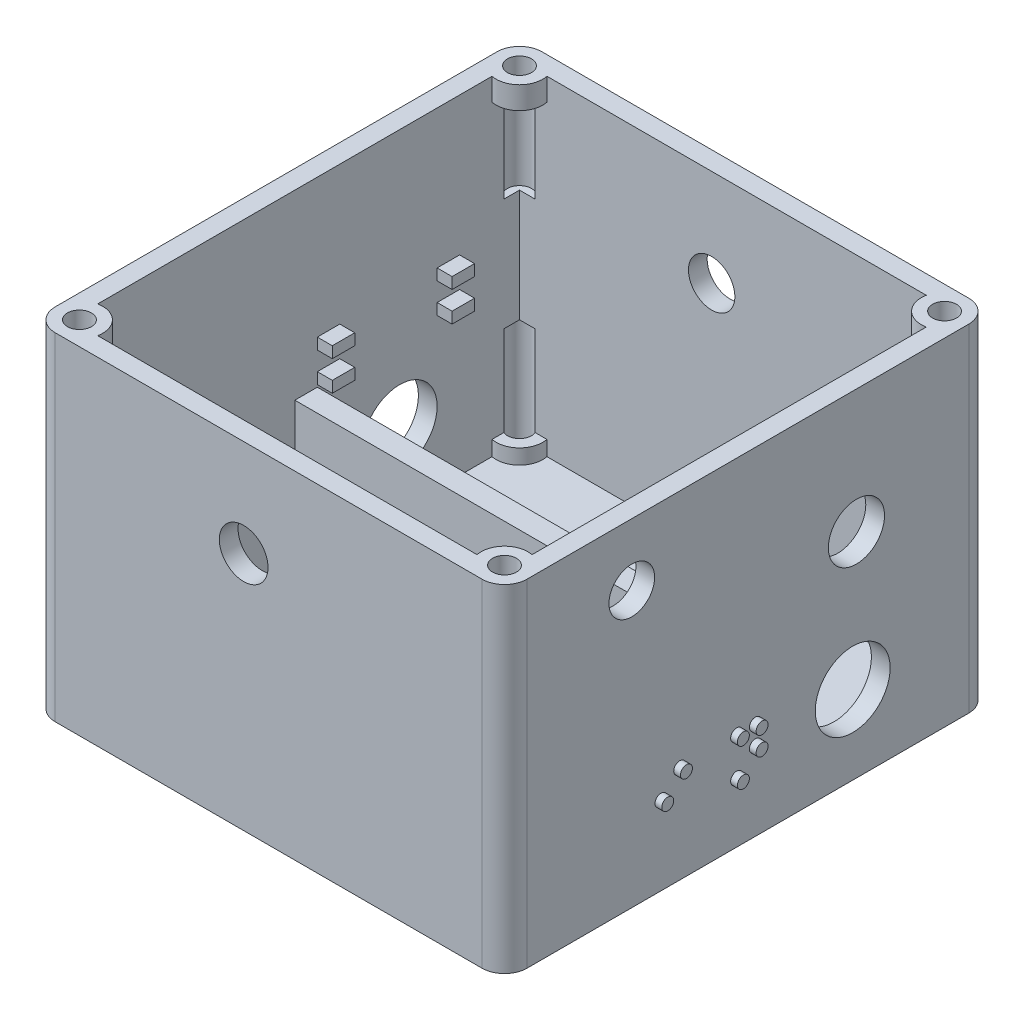
from build123d import *

# Parameters (mm, degrees)
BASE_SKETCH_W                         = 63
BASE_SKETCH_H                         = 65
BASE_SKETCH_W_2                       = 58
BASE_SKETCH_H_2                       = 60
WALLS_DEPTH                           = 45
CLIPS_START                           = 2.5
CLIPS_TOP_OUTLINE_W                   = 1.5
CLIPS_TOP_OUTLINE_H                   = 3
CLIPS_TOP_DEPTH                       = 2
CLIPS_BOTTOM_OUTLINE_W                = 1.5
CLIPS_BOTTOM_OUTLINE_H                = 3
CLIPS_BOTTOM_DEPTH                    = 2
PHONE_START                           = 70
JACK_ENCODER_R                        = 3.05
JACK_ENCODER_R_2                      = 3.75
PHONE_JACK_ENCODER_DEPTH              = 23
FILLET1_R                             = 3
ON_OFF_START                          = -50
ON_OFF_SWITCH_R                       = 3.1
ON_OFF_TOGGLE_SWITCH_HOLE_DEPTH       = 23
BRAILLE_START                         = -65
ON_OFF_SWITCH_7_R                     = 0.8
BRAILLE_ON_OFF_DEPTH                  = 0.9
GUITAR_JACKS_DEPTH                    = 101.140201717
GUITAR_JACKS_DEPTH_BACK               = 101.140201717
GUITAR_PORTS_R                        = 5
POTENTIOMETER_HOLE_R                  = 3.25
POTENTIOMETER_DEPTH                   = 10
INNER_WALL_DEPTH                      = 20.7
BASE_SKETCH_12_W                      = 58
BASE_SKETCH_12_H                      = 27
INNER_WALL_BOTTOM_DEPTH               = 1
HOLES_4_R                             = 1.6
MOUNTING_HOLES_BOTTOM_CUT_DEPTH       = 15
MOUNTING_START                        = 30
HOLES_R                               = 1.6
MOUNTING_HOLES_TOP_CUT_DEPTH          = 15
HOLES_6_R                             = 3.115503651
HOLES_6_R_2                           = 1.6
MOUNTING_HOLES_REINFORCE_BOTTOM_DEPTH = 3
MOUNTING_START_2                      = 42
HOLES_7_R                             = 3.115503651
HOLES_7_R_2                           = 1.6
MOUNTING_HOLES_REINFORCE_TOP_DEPTH    = 3
BRAILLE_EXTRUDE_START                 = 63
BRAILLE_IN_R                          = 0.8
BRAILLE_EXTRUDE_IN_DEPTH              = 0.9
BRAILLE_OUT_R                         = 0.8
BRAILLE_EXTRUDE_OUT_DEPTH             = 0.9


# Read off the part's stored shape, not the designer's step: Clips Top, Clips Bottom
with BuildPart() as part:
    # Base Sketch → Walls (new body)
    with BuildSketch(Plane(origin=(0, 0, 0), x_dir=(1, 0, 0), z_dir=(0, 1, 0))):
        with Locations((31.5, 32.5)):
            Rectangle(BASE_SKETCH_W, BASE_SKETCH_H)
        with Locations((31.5, 32.5)):
            Rectangle(BASE_SKETCH_W_2, BASE_SKETCH_H_2, mode=Mode.SUBTRACT)
    extrude(amount=WALLS_DEPTH)

    # Clips Top outline → Clips Top (add)
    with BuildSketch(Plane.YZ.offset(CLIPS_START)):
        with Locations((25.75, -53)):
            Rectangle(CLIPS_TOP_OUTLINE_W, CLIPS_TOP_OUTLINE_H)
        with Locations((25.75, -37)):
            Rectangle(CLIPS_TOP_OUTLINE_W, CLIPS_TOP_OUTLINE_H)
    extrude(amount=CLIPS_TOP_DEPTH)

    # Clips Bottom outline → Clips Bottom (add)
    with BuildSketch(Plane.YZ.offset(CLIPS_START)):
        with Locations((21.75, -53)):
            Rectangle(CLIPS_BOTTOM_OUTLINE_W, CLIPS_BOTTOM_OUTLINE_H)
        with Locations((21.75, -37)):
            Rectangle(CLIPS_BOTTOM_OUTLINE_W, CLIPS_BOTTOM_OUTLINE_H)
    extrude(amount=CLIPS_BOTTOM_DEPTH)

    # Jack & Encoder → Phone Jack+Encoder (cut)
    with BuildSketch(Plane(origin=(0, 0, 0), x_dir=(0, 0, -1), z_dir=(1, 0, 0)).offset(PHONE_START)):
        with Locations((17, 36.7)):
            Circle(JACK_ENCODER_R)
        with Locations((47, 28.498025774)):
            Circle(JACK_ENCODER_R_2)
    extrude(amount=-PHONE_JACK_ENCODER_DEPTH, mode=Mode.SUBTRACT)

    # Fillet1
    fillet1_edges = [part.edges().sort_by_distance(p)[0] for p in [
        (0, 22.5, 0),
        (0, 22.5, -65),
        (63, 22.5, -65),
        (63, 22.5, 0),
    ]]
    fillet(fillet1_edges, radius=FILLET1_R)

    # On-off Switch → On-off toggle switch hole (cut)
    with BuildSketch(Plane.XY.offset(ON_OFF_START)):
        with Locations((28.164403996, 32.056003541)):
            Circle(ON_OFF_SWITCH_R)
    extrude(amount=-ON_OFF_TOGGLE_SWITCH_HOLE_DEPTH, mode=Mode.SUBTRACT)

    # On-off Switch<7> → Braille On-off (add)
    with BuildSketch(Plane.XY.offset(BRAILLE_START)):
        with Locations((8.064403996, 30.988882574)):
            Circle(ON_OFF_SWITCH_7_R)
        with Locations((8.064403996, 33.488882574)):
            Circle(ON_OFF_SWITCH_7_R)
        with Locations((10.564403996, 28.488882574)):
            Circle(ON_OFF_SWITCH_7_R)
        with Locations((15.664403996, 30.988882574)):
            Circle(ON_OFF_SWITCH_7_R)
        with Locations((18.164403996, 28.488882574)):
            Circle(ON_OFF_SWITCH_7_R)
        with Locations((18.164403996, 33.488882574)):
            Circle(ON_OFF_SWITCH_7_R)
        with Locations((55.864403996, 33.079675966)):
            Circle(ON_OFF_SWITCH_7_R)
        with Locations((38.164403996, 33.079675966)):
            Circle(ON_OFF_SWITCH_7_R)
        with Locations((40.664403996, 33.079675966)):
            Circle(ON_OFF_SWITCH_7_R)
        with Locations((40.664403996, 30.579675966)):
            Circle(ON_OFF_SWITCH_7_R)
        with Locations((45.764403996, 33.079675966)):
            Circle(ON_OFF_SWITCH_7_R)
        with Locations((48.264403996, 33.079675966)):
            Circle(ON_OFF_SWITCH_7_R)
        with Locations((48.264403996, 30.579675966)):
            Circle(ON_OFF_SWITCH_7_R)
        with Locations((55.864403996, 28.079675966)):
            Circle(ON_OFF_SWITCH_7_R)
        with Locations((53.364403996, 30.579675966)):
            Circle(ON_OFF_SWITCH_7_R)
    extrude(amount=-BRAILLE_ON_OFF_DEPTH)

    # Guitar ports → Guitar jacks (cut, two sides: drawn at the far end of the back side and taken through both)
    with BuildSketch(Plane(origin=(2.5, 0, 0), x_dir=(0, 0, -1), z_dir=(1, 0, 0)).offset(-GUITAR_JACKS_DEPTH_BACK)):
        with Locations((46.5, 10.5)):
            Circle(GUITAR_PORTS_R)
    extrude(amount=GUITAR_JACKS_DEPTH + GUITAR_JACKS_DEPTH_BACK, mode=Mode.SUBTRACT)

    # Potentiometer hole → Potentiometer (cut)
    with BuildSketch(Plane.XY):
        with Locations((28.164403996, 32.056003541)):
            Circle(POTENTIOMETER_HOLE_R)
    extrude(amount=-POTENTIOMETER_DEPTH, mode=Mode.SUBTRACT)

    # Base Sketch<11> → Inner-wall (add)
    with BuildSketch(Plane(origin=(0, 0, 0), x_dir=(1, 0, 0), z_dir=(0, 1, 0))):
        Polygon((60.5, 32.5), (60.5, 35.5), (4.5, 35.5), (2.5, 35.5), (2.5, 32.5), align=None)
    extrude(amount=INNER_WALL_DEPTH)

    # Base Sketch<12> → Inner-wall bottom (add)
    with BuildSketch(Plane(origin=(0, 0, 0), x_dir=(1, 0, 0), z_dir=(0, 1, 0))):
        with Locations((31.5, 49)):
            Rectangle(BASE_SKETCH_12_W, BASE_SKETCH_12_H)
    extrude(amount=INNER_WALL_BOTTOM_DEPTH)

    # Holes<4> → Mounting Holes Bottom Cut (cut)
    with BuildSketch(Plane(origin=(0, 0, 0), x_dir=(1, 0, 0), z_dir=(0, 1, 0))):
        with Locations(Location((59.884496349, 61.884496349, 0), (0, 0, 157.375517099))):
            Circle(HOLES_4_R)
        with Locations(Location((3.115503651, 61.884496349, 0), (0, 0, 22.624482901))):
            Circle(HOLES_4_R)
        with Locations((3.115503651, 3.115503651)):
            Circle(HOLES_4_R)
        with Locations((59.884496349, 3.115503651)):
            Circle(HOLES_4_R)
    extrude(amount=MOUNTING_HOLES_BOTTOM_CUT_DEPTH, mode=Mode.SUBTRACT)

    # Holes → Mounting Holes Top Cut (cut)
    with BuildSketch(Plane(origin=(0, 0, 0), x_dir=(1, 0, 0), z_dir=(0, 1, 0)).offset(MOUNTING_START)):
        with Locations(Location((3.115503651, 61.884496349, 0), (0, 0, 22.624482901))):
            Circle(HOLES_R)
        with Locations(Location((59.884496349, 61.884496349, 0), (0, 0, 157.375517099))):
            Circle(HOLES_R)
        with Locations((59.884496349, 3.115503651)):
            Circle(HOLES_R)
        with Locations((3.115503651, 3.115503651)):
            Circle(HOLES_R)
    extrude(amount=MOUNTING_HOLES_TOP_CUT_DEPTH, mode=Mode.SUBTRACT)

    # Holes<6> → Mounting Holes Reinforce Bottom (add)
    # profile 1 of 4: a face of its own
    with BuildSketch(Plane(origin=(0, 0, 0), x_dir=(1, 0, 0), z_dir=(0, 1, 0))):
        with Locations((3.115503651, 3.115503651)):
            Circle(HOLES_6_R)
        with Locations(Location((3.115503651, 3.115503651, 0), (0, 0, 112.624482901))):
            Circle(HOLES_6_R_2, mode=Mode.SUBTRACT)
    # profile 2 of 4: a face of its own
    with BuildSketch(Plane(origin=(0, 0, 0), x_dir=(1, 0, 0), z_dir=(0, 1, 0))):
        with Locations((59.884496349, 3.115503651)):
            Circle(HOLES_6_R)
        with Locations(Location((59.884496349, 3.115503651, 0), (0, 0, 67.375517099))):
            Circle(HOLES_6_R_2, mode=Mode.SUBTRACT)
    # profile 3 of 4: a face of its own
    with BuildSketch(Plane(origin=(0, 0, 0), x_dir=(1, 0, 0), z_dir=(0, 1, 0))):
        with Locations((59.884496349, 61.884496349)):
            Circle(HOLES_6_R)
        with Locations(Location((59.884496349, 61.884496349, 0), (0, 0, 157.375517099))):
            Circle(HOLES_6_R_2, mode=Mode.SUBTRACT)
    # profile 4 of 4: a face of its own
    with BuildSketch(Plane(origin=(0, 0, 0), x_dir=(1, 0, 0), z_dir=(0, 1, 0))):
        with Locations((3.115503651, 61.884496349)):
            Circle(HOLES_6_R)
        with Locations(Location((3.115503651, 61.884496349, 0), (0, 0, 22.624482901))):
            Circle(HOLES_6_R_2, mode=Mode.SUBTRACT)
    extrude(amount=MOUNTING_HOLES_REINFORCE_BOTTOM_DEPTH)

    # Holes<7> → Mounting Holes Reinforce Top (add)
    # profile 1 of 4: a face of its own
    with BuildSketch(Plane(origin=(0, 0, 0), x_dir=(1, 0, 0), z_dir=(0, 1, 0)).offset(MOUNTING_START_2)):
        with Locations((3.115503651, 3.115503651)):
            Circle(HOLES_7_R)
        with Locations(Location((3.115503651, 3.115503651, 0), (0, 0, 112.624482901))):
            Circle(HOLES_7_R_2, mode=Mode.SUBTRACT)
    # profile 2 of 4: a face of its own
    with BuildSketch(Plane(origin=(0, 0, 0), x_dir=(1, 0, 0), z_dir=(0, 1, 0)).offset(MOUNTING_START_2)):
        with Locations((59.884496349, 3.115503651)):
            Circle(HOLES_7_R)
        with Locations(Location((59.884496349, 3.115503651, 0), (0, 0, 67.375517099))):
            Circle(HOLES_7_R_2, mode=Mode.SUBTRACT)
    # profile 3 of 4: a face of its own
    with BuildSketch(Plane(origin=(0, 0, 0), x_dir=(1, 0, 0), z_dir=(0, 1, 0)).offset(MOUNTING_START_2)):
        with Locations((59.884496349, 61.884496349)):
            Circle(HOLES_7_R)
        with Locations(Location((59.884496349, 61.884496349, 0), (0, 0, 157.375517099))):
            Circle(HOLES_7_R_2, mode=Mode.SUBTRACT)
    # profile 4 of 4: a face of its own
    with BuildSketch(Plane(origin=(0, 0, 0), x_dir=(1, 0, 0), z_dir=(0, 1, 0)).offset(MOUNTING_START_2)):
        with Locations((3.115503651, 61.884496349)):
            Circle(HOLES_7_R)
        with Locations(Location((3.115503651, 61.884496349, 0), (0, 0, 22.624482901))):
            Circle(HOLES_7_R_2, mode=Mode.SUBTRACT)
    extrude(amount=MOUNTING_HOLES_REINFORCE_TOP_DEPTH)

    # Braille In → Braille-extrude In (add)
    with BuildSketch(Plane(origin=(0, 0, 0), x_dir=(0, 0, -1), z_dir=(1, 0, 0)).offset(BRAILLE_EXTRUDE_START)):
        with Locations(Location((20.9, 10.5, 0), (0, 0, 180))):
            Circle(BRAILLE_IN_R)
        with Locations(Location((23.4, 13, 0), (0, 0, 180))):
            Circle(BRAILLE_IN_R)
        with Locations(Location((31, 13, 0), (0, 0, 180))):
            Circle(BRAILLE_IN_R)
        with Locations(Location((33.5, 10.5, 0), (0, 0, 180))):
            Circle(BRAILLE_IN_R)
        with Locations(Location((33.5, 13, 0), (0, 0, 180))):
            Circle(BRAILLE_IN_R)
        with Locations(Location((31, 8, 0), (0, 0, 180))):
            Circle(BRAILLE_IN_R)
    extrude(amount=BRAILLE_EXTRUDE_IN_DEPTH)

    # Braille Out → Braille-extrude Out (add)
    with BuildSketch(Plane(origin=(0, 0, 0), x_dir=(0, 0, -1), z_dir=(1, 0, 0))):
        with Locations((17.3, 13)):
            Circle(BRAILLE_OUT_R)
        with Locations((17.3, 10.5)):
            Circle(BRAILLE_OUT_R)
        with Locations((19.8, 10.5)):
            Circle(BRAILLE_OUT_R)
        with Locations((19.8, 8)):
            Circle(BRAILLE_OUT_R)
        with Locations((24.9, 8)):
            Circle(BRAILLE_OUT_R)
        with Locations((27.4, 8)):
            Circle(BRAILLE_OUT_R)
        with Locations((27.4, 13)):
            Circle(BRAILLE_OUT_R)
        with Locations((32.5, 10.5)):
            Circle(BRAILLE_OUT_R)
        with Locations((35, 13)):
            Circle(BRAILLE_OUT_R)
        with Locations((35, 8)):
            Circle(BRAILLE_OUT_R)
    extrude(amount=-BRAILLE_EXTRUDE_OUT_DEPTH)


solid = part.part
